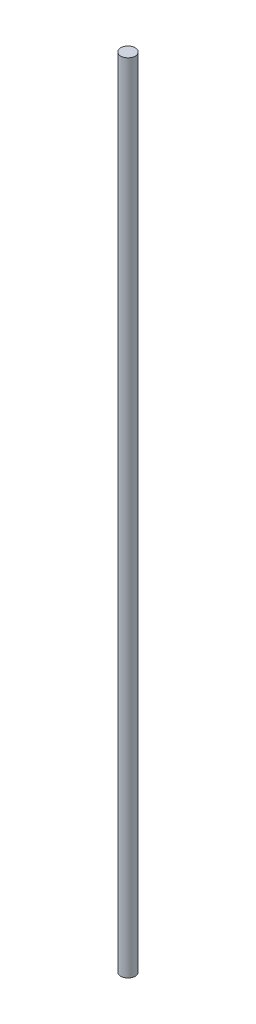
from build123d import *

# Parameters (mm, degrees)
SKETCH1_R           = 1.5
BOSS_EXTRUDE1_DEPTH = 165


with BuildPart() as part:
    # Sketch1 → Boss-Extrude1 (new body)
    with BuildSketch(Plane(origin=(0, 0, 0), x_dir=(1, 0, 0), z_dir=(0, 1, 0))):
        Circle(SKETCH1_R)
    extrude(amount=BOSS_EXTRUDE1_DEPTH)


solid = part.part
